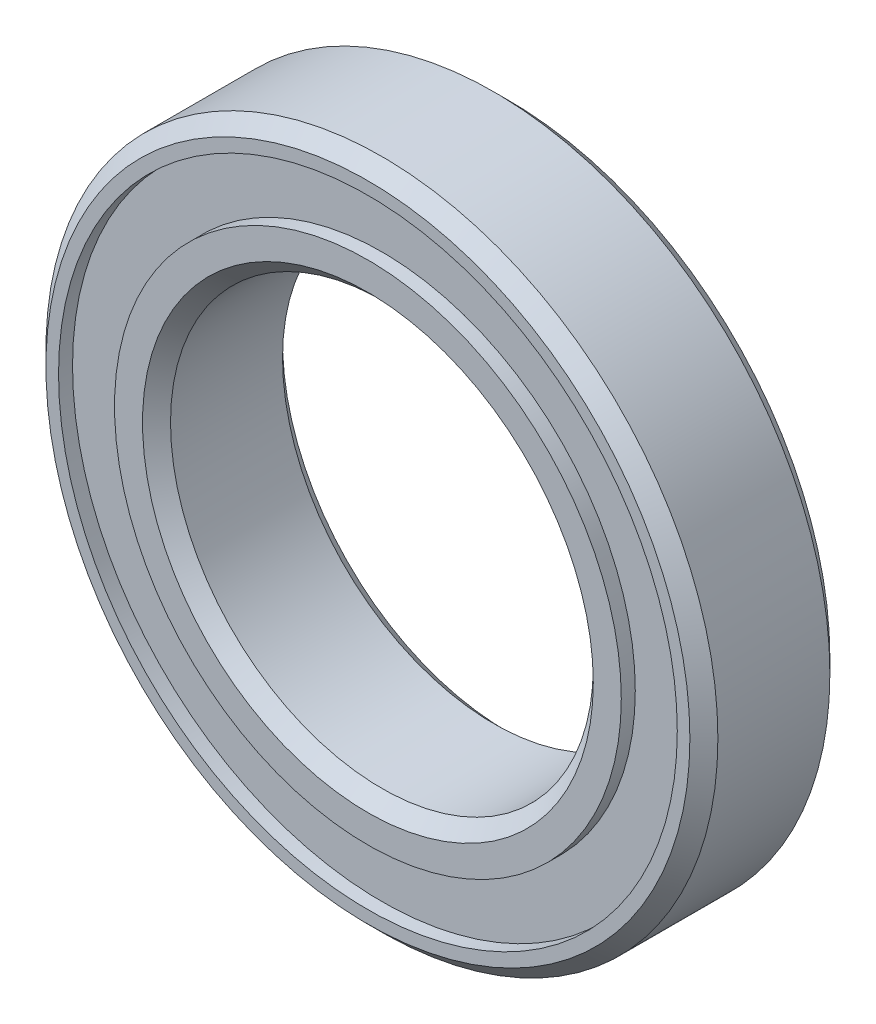
from build123d import *

# Parameters (mm, degrees)
ESBO_O1_R                = 12
ESBO_O1_R_2              = 7.55
RESSALTO_EXTRUS_O1_DEPTH = 5
ESBO_O2_R                = 11.05
ESBO_O2_R_2              = 9.05
CORTE_EXTRUS_O1_DEPTH    = 0.5
CORTE_EXTRUS_O2_START    = -0.5
ESBO_O3_R                = 11.05
ESBO_O3_R_2              = 9.05
CORTE_EXTRUS_O2_DEPTH    = 0.5
CHANFRO1_SIZE            = 0.5


with BuildPart() as part:
    # Esboço1 → Ressalto-extrusão1 (new body)
    with BuildSketch(Plane.XY):
        Circle(ESBO_O1_R)
        Circle(ESBO_O1_R_2, mode=Mode.SUBTRACT)
    extrude(amount=RESSALTO_EXTRUS_O1_DEPTH)

    # Esboço2 → Corte-extrusão1 (cut)
    with BuildSketch(Plane.XY.offset(5)):
        Circle(ESBO_O2_R)
        Circle(ESBO_O2_R_2, mode=Mode.SUBTRACT)
    extrude(amount=-CORTE_EXTRUS_O1_DEPTH, mode=Mode.SUBTRACT)

    # Esboço3 → Corte-extrusão2 (cut)
    with BuildSketch(Plane(origin=(0, 0, 0), x_dir=(-1, 0, 0), z_dir=(0, 0, -1)).offset(CORTE_EXTRUS_O2_START)):
        Circle(ESBO_O3_R)
        Circle(ESBO_O3_R_2, mode=Mode.SUBTRACT)
    extrude(amount=CORTE_EXTRUS_O2_DEPTH, mode=Mode.SUBTRACT)

    # Chanfro1
    chanfro1_edges = [part.edges().sort_by_distance(p)[0] for p in [
        (-12, 0, 5),
        (-12, 0, 0),
        (-7.55, 0, 0),
        (-7.55, 0, 5),
    ]]
    chamfer(chanfro1_edges, length=CHANFRO1_SIZE)


solid = part.part
